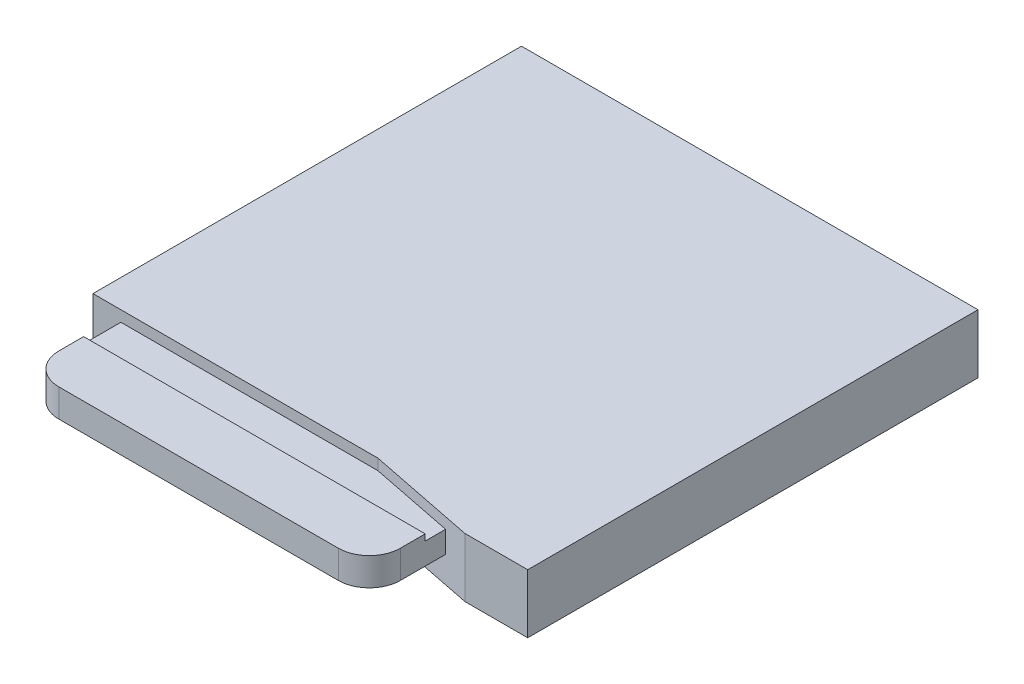
from build123d import *

# Parameters (mm, degrees)
SKETCH1_W               = 14.7
SKETCH1_H               = 14.5
BOSS_EXTRUDE1_DEPTH     = 1.9
CUT_EXTRUDE1_DEPTH      = 11.497380626
CUT_EXTRUDE1_DEPTH_BACK = 1.9
SKETCH3_W               = 11
SKETCH3_H               = 0.7
BOSS_EXTRUDE2_DEPTH     = 3
SKETCH4_W               = 11
SKETCH4_H               = 1.8
BOSS_EXTRUDE3_DEPTH     = 0.2
FILLET1_R               = 1
SKETCH5_R               = 0.4
BOSS_EXTRUDE4_DEPTH     = 0.55
FILLET2_R               = 0.1


with BuildPart() as part:
    # Sketch1 → Boss-Extrude1 (new body)
    with BuildSketch(Plane(origin=(0, 0, 0), x_dir=(1, 0, 0), z_dir=(0, 1, 0))):
        Rectangle(SKETCH1_W, SKETCH1_H)
    extrude(amount=BOSS_EXTRUDE1_DEPTH)

    # Sketch2 → Cut-Extrude1 (cut, two sides: drawn at the far end of the back side and taken through both)
    with BuildSketch(Plane(origin=(0, 1.9, 0), x_dir=(1, 0, 0), z_dir=(0, 1, 0)).offset(-CUT_EXTRUDE1_DEPTH_BACK)):
        Polygon((-57.675178239, -6.55), (-7.35, -6.55), (1.824899914, -6.55), (5.328458875, -7.25), (54.6782833, -17.109938843), (45.259811524, -117.318654275), (-67.093650016, -106.758715432), align=None)
    extrude(amount=CUT_EXTRUDE1_DEPTH + CUT_EXTRUDE1_DEPTH_BACK, mode=Mode.SUBTRACT)

    # Sketch3 → Boss-Extrude2 (add)
    with BuildSketch(Plane.XY.offset(6.55)):
        with Locations((-0.95, 1.2)):
            Rectangle(SKETCH3_W, SKETCH3_H)
    extrude(amount=BOSS_EXTRUDE2_DEPTH)

    # Sketch4 → Boss-Extrude3 (add)
    with BuildSketch(Plane(origin=(0, 1.55, 0), x_dir=(1, 0, 0), z_dir=(0, 1, 0))):
        with Locations((-0.95, -8.65)):
            Rectangle(SKETCH4_W, SKETCH4_H)
    extrude(amount=BOSS_EXTRUDE3_DEPTH)

    # Fillet1
    fillet1_edges = [part.edges().sort_by_distance(p)[0] for p in [
        (-6.45, 1.3, 9.55),
        (4.55, 1.3, 9.55),
    ]]
    fillet(fillet1_edges, radius=FILLET1_R)

    # Sketch5 → Boss-Extrude4 (add)
    with BuildSketch(Plane.XZ):
        with Locations((-4.95, 3.25)):
            Circle(SKETCH5_R)
        with Locations((3.05, 3.25)):
            Circle(SKETCH5_R)
    extrude(amount=BOSS_EXTRUDE4_DEPTH)

    # Fillet2
    fillet2_edges = [part.edges().sort_by_distance(p)[0] for p in [
        (2.65, -0.55, 3.25),
        (-5.35, -0.55, 3.25),
    ]]
    fillet(fillet2_edges, radius=FILLET2_R)


solid = part.part
